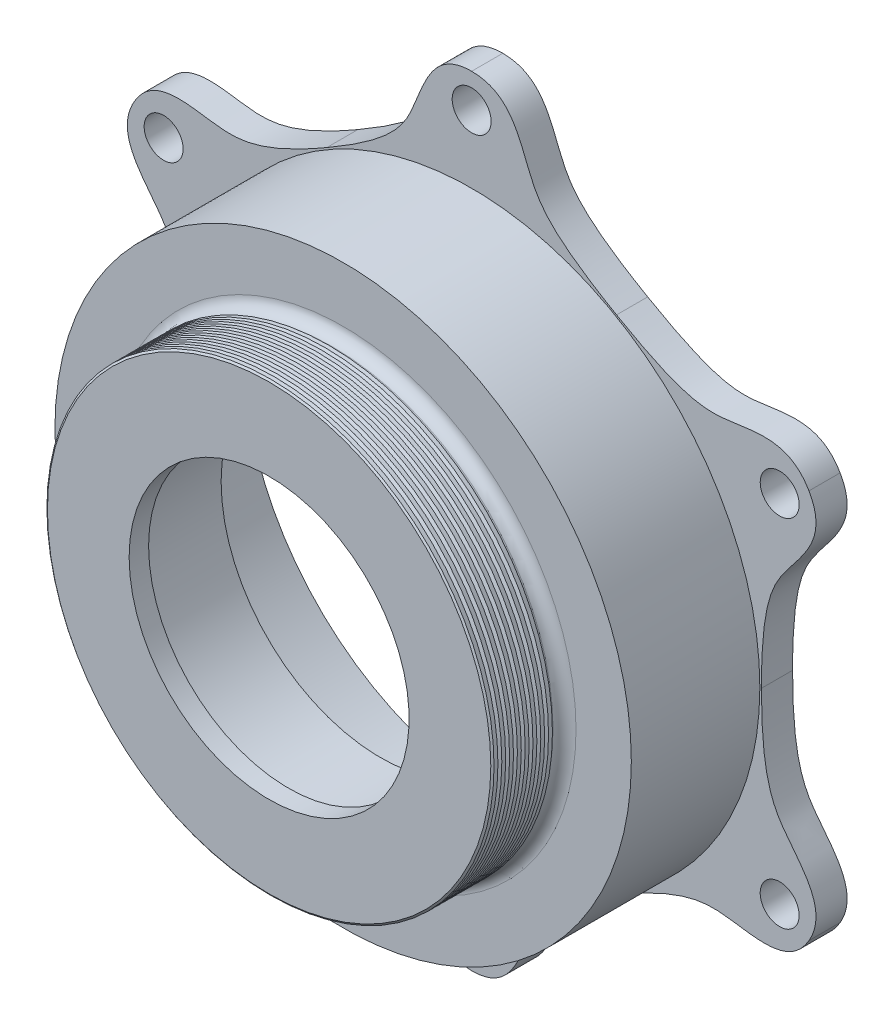
from build123d import *

# Parameters (mm, degrees)
EXTRUDE1_REACH     = 97.681
SKETCH2_R          = 3.175
CIRPATTERN1_COUNT  = 6
LPATTERN1_COUNT    = 8
LPATTERN1_PITCH    = 1.27
SKETCH5_W          = 2.051091911
SKETCH5_H          = 0.508
FILLET1_R          = 2.032
FILLET3_R          = 0.508
CUT_EXTRUDE1_DEPTH = 96.680825665
CIRPATTERN2_COUNT  = 6
FILLET2_R          = 1.5875


with BuildPart() as part:
    # Sketch1 → Revolve1 (revolve)
    with BuildSketch(Plane(origin=(0, 0, 0), x_dir=(0, 0, -1), z_dir=(1, 0, 0)), mode=Mode.PRIVATE) as revolve1_sk:
        Polygon((-33.02, 22.825), (-29.845, 22.825), (-29.845, 26), (-14.845, 26), (-14.845, 42.2275), (5.08, 42.2275), (5.08, 63.5), (0, 63.5), (0, 46.99), (-20.955, 46.99), (-20.955, 36.449), (-33.02, 36.449), (-33.02, 30.099), align=None)
    revolve(revolve1_sk.sketch.rotate(Axis((0, 0, 0), (0, 0, 1)), 90), axis=Axis((0, 0, 0), (0, 0, 1)))

    # Sketch2 → Extrude1 (cut, up to next)
    with BuildSketch(Plane.XY, mode=Mode.PRIVATE) as extrude1_sk1:
        with Locations((0, 57.9882)):
            Circle(SKETCH2_R)
    extrude1_tool1 = extrude(extrude1_sk1.sketch, amount=-EXTRUDE1_REACH, mode=Mode.PRIVATE) & part.part
    extrude1 = extrude1_tool1.solids().sort_by_distance((0, 57.9882, 0))[0]
    add(extrude1, mode=Mode.SUBTRACT)

    # CirPattern1: Extrude1 ×6 about axis
    cirpattern1_axis = Axis((0, 0, 0), (0, 0, 1))
    for i in range(1, CIRPATTERN1_COUNT):
        add(extrude1.rotate(cirpattern1_axis, i * 360 / CIRPATTERN1_COUNT), mode=Mode.SUBTRACT)

    # Sketch3 → Cut-Revolve1 (revolve, cut)
    with BuildSketch(Plane(origin=(0, 0, 0), x_dir=(0, 0, -1), z_dir=(1, 0, 0)), mode=Mode.PRIVATE) as cut_revolve1_sk:
        Polygon((-32.799835974, 36.449), (-33.166091911, 35.941), (-33.166091911, 36.864932023), (-31.896091911, 36.864932023), (-31.896091911, 35.941), (-32.531091911, 35.941), (-32.164835974, 36.449), align=None)
    cut_revolve1 = revolve(cut_revolve1_sk.sketch.rotate(Axis((0, 0, -58.1544), (0, 0, 1)), 90), axis=Axis((0, 0, -58.1544), (0, 0, 1)), mode=Mode.SUBTRACT)

    # LPattern1: Cut-Revolve1 ×8
    with Locations(*[(0, 0, -i * LPATTERN1_PITCH) for i in range(1, LPATTERN1_COUNT)]):
        add(cut_revolve1, mode=Mode.SUBTRACT)

    # Sketch5 → Cut-Revolve2 (revolve, cut)
    with BuildSketch(Plane(origin=(0, 0, 0), x_dir=(0, 0, -1), z_dir=(1, 0, 0)), mode=Mode.PRIVATE) as cut_revolve2_sk:
        with Locations((-21.980545956, 36.195)):
            Rectangle(SKETCH5_W, SKETCH5_H)
    revolve(cut_revolve2_sk.sketch.rotate(Axis((0, 0, -58.1544), (0, 0, 1)), 90), axis=Axis((0, 0, -58.1544), (0, 0, 1)), mode=Mode.SUBTRACT)

    # Fillet1
    fillet1_edges = [part.edges().sort_by_distance(p)[0] for p in [
        (35.941, 0, 20.955),
    ]]
    fillet(fillet1_edges, radius=FILLET1_R)

    # Fillet3
    # the kernel refuses this fillet: 0.508 mm, written as the material it adds along each edge
    with BuildSketch(Plane(origin=(0, 0, 23.641091911), x_dir=(-1, 0, 0), z_dir=(0, 1, 0))) as fillet3_piece_1:
        with BuildLine():
            CenterArc((36.464950257, -0.874005471), FILLET3_R, 91.799276876, 96.497482637)
            Line((36.449, -0.366255937), (36.447404974, -0.315480984))
            ThreePointArc((36.447404974, -0.315480984), (36.224709168, -0.141921108), (35.970709168, 0.04120686))
            Line((35.970709168, 0.04120686), (35.8902, 0))
            ThreePointArc((35.8902, 0), (35.8902, -0.654091911), (35.911998685, -0.954640443))
            Line((35.911998685, -0.954640443), (35.96226701, -0.947309991))
        make_face()
    revolve(axis=Axis((0, 0, 23.641091911), (0, 0, 1)))

    # Sketch4 → Cut-Extrude1 (cut, through all)
    with BuildSketch(Plane.XY):
        with BuildLine():
            ThreePointArc((54.99261314, 31.75), (31.75, 54.99261314), (0, 63.5))
            add(Edge.make_bspline(
                [(0, 63.5), (6.075444576, 63.5), (9.03541603, 53.58962581), (12.704905494, 47.217491628), (23.622, 40.914504176)],
                knots=[0, 0, 0, 0, 0.515622234, 1, 1, 1, 1], degree=3))
            add(Edge.make_bspline(
                [(54.99261314, 31.75), (51.954890852, 37.011489342), (41.892269316, 34.619712721), (34.539094506, 34.611516724), (23.622, 40.914504176)],
                knots=[0, 0, 0, 0, 0.515622234, 1, 1, 1, 1], degree=3))
        make_face()
    cut_extrude1 = extrude(amount=-CUT_EXTRUDE1_DEPTH, mode=Mode.SUBTRACT)

    # CirPattern2: Cut-Extrude1 ×6 about axis
    cirpattern2_axis = Axis((0, 0, -58.1544), (0, 0, 1))
    for i in range(1, CIRPATTERN2_COUNT):
        add(cut_extrude1.rotate(cirpattern2_axis, i * 360 / CIRPATTERN2_COUNT), mode=Mode.SUBTRACT)

    # Fillet2
    fillet2_edges = [part.edges().sort_by_distance(p)[0] for p in [
        (42.2275, 0, 14.845),
    ]]
    fillet(fillet2_edges, radius=FILLET2_R)


solid = part.part
